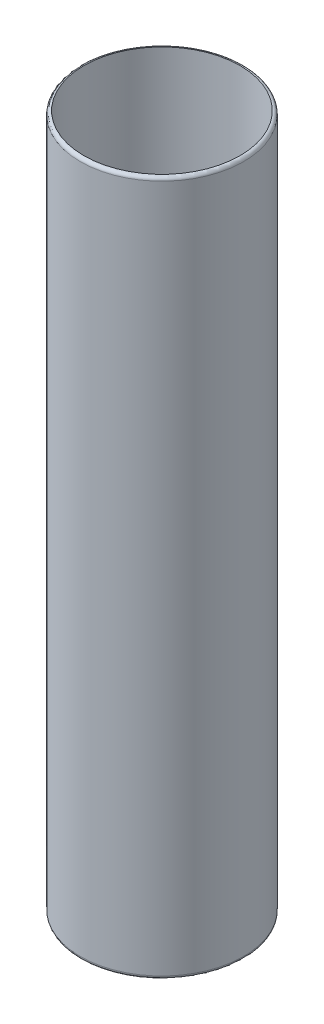
from build123d import *

# Parameters (mm, degrees)
CROQUIS1_R              = 11.73
SALIENTE_EXTRUIR1_DEPTH = 100
CROQUIS2_R              = 11.23
CORTAR_EXTRUIR1_DEPTH   = 102.366591143
REDONDEO1_R             = 0.5
REDONDEO4_R             = 0.5


with BuildPart() as part:
    # Croquis1 → Saliente-Extruir1 (new body)
    with BuildSketch(Plane(origin=(0, 0, 0), x_dir=(1, 0, 0), z_dir=(0, 1, 0))):
        with Locations(Location((0, 0, 0), (0, 0, 270))):
            Circle(CROQUIS1_R)
    extrude(amount=SALIENTE_EXTRUIR1_DEPTH)

    # Croquis2 → Cortar-Extruir1 (cut, through all)
    with BuildSketch(Plane(origin=(0, 100, 0), x_dir=(1, 0, 0), z_dir=(0, 1, 0))):
        with Locations(Location((0, 0, 0), (0, 0, 270))):
            Circle(CROQUIS2_R)
    extrude(amount=-CORTAR_EXTRUIR1_DEPTH, mode=Mode.SUBTRACT)

    # Redondeo1
    redondeo1_edges = [part.edges().sort_by_distance(p)[0] for p in [
        (0, 100, -11.73),
    ]]
    fillet(redondeo1_edges, radius=REDONDEO1_R - 0.0001)  # a hair under: the kernel refuses the full size

    # Redondeo4
    redondeo4_edges = [part.edges().sort_by_distance(p)[0] for p in [
        (0, 0, -11.73),
    ]]
    fillet(redondeo4_edges, radius=REDONDEO4_R - 0.0001)  # a hair under: the kernel refuses the full size


solid = part.part
